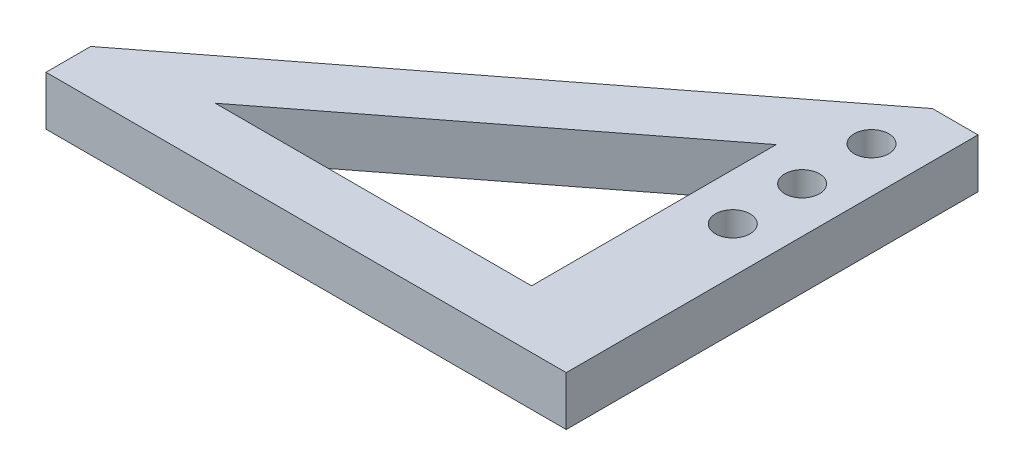
from build123d import *

# Parameters (mm, degrees)
SKETCH1_R           = 0.5715
BOSS_EXTRUDE1_DEPTH = 1.6256


with BuildPart() as part:
    # Sketch1 → Boss-Extrude1 (new body)
    with BuildSketch(Plane(origin=(0, 0, 0), x_dir=(1, 0, 0), z_dir=(0, 1, 0))):
        Polygon((1.905, 1.4732), (17.54785055, 13.570337759), (19.05, 13.570337759), (19.05, 0), (1.905, 0), align=None)
        with Locations((17.54785055, 11.562216741)):
            Circle(SKETCH1_R, mode=Mode.SUBTRACT)
        with Locations((17.54785055, 9.276216741)):
            Circle(SKETCH1_R, mode=Mode.SUBTRACT)
        with Locations((17.54785055, 6.990216741)):
            Circle(SKETCH1_R, mode=Mode.SUBTRACT)
        Polygon((5.577391241, 1.905), (16.002, 1.905), (16.002, 9.96669744), align=None, mode=Mode.SUBTRACT)
    extrude(amount=BOSS_EXTRUDE1_DEPTH)


solid = part.part
